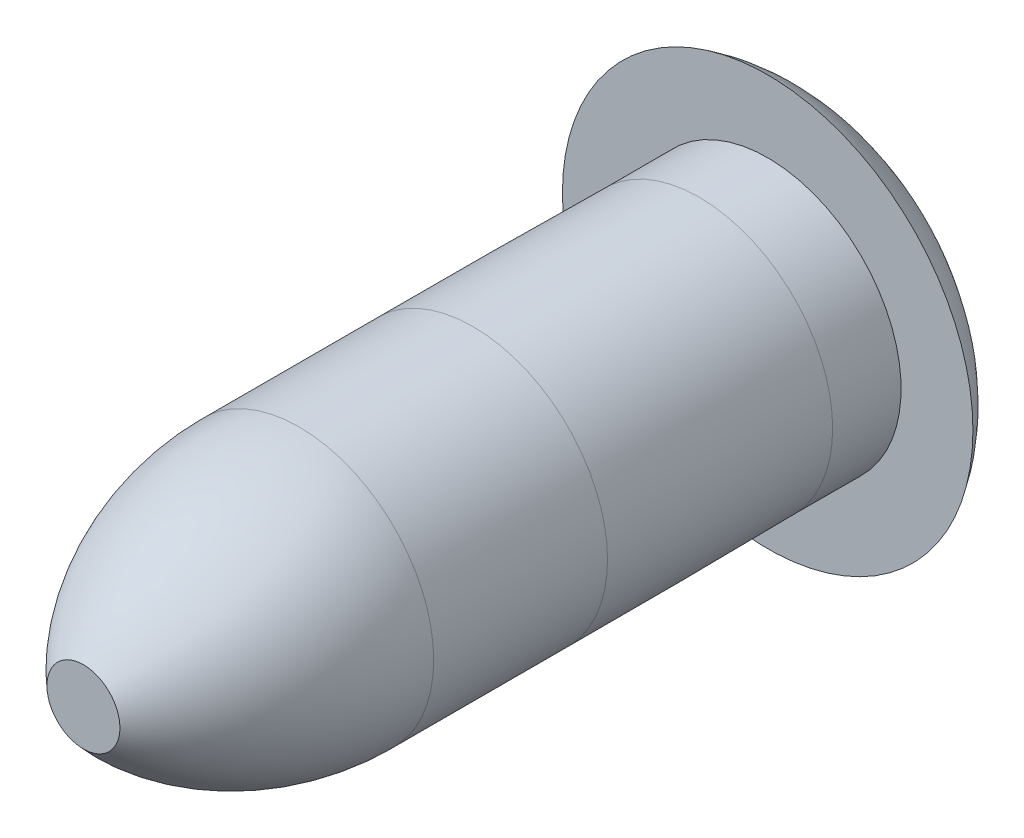
from build123d import *

# Parameters (mm, degrees)
SKETCH1_R           = 2.925
BOSS_EXTRUDE1_DEPTH = 1.5


with BuildPart() as part:
    # Sketch1 → Boss-Extrude1 (new body)
    with BuildSketch(Plane.XY):
        Circle(SKETCH1_R)
    extrude(amount=BOSS_EXTRUDE1_DEPTH)

    # Sketch2 → Revolve1 (revolve)
    with BuildSketch(Plane(origin=(0, 0, 0), x_dir=(1, 0, 0), z_dir=(0, 1, 0))):
        with BuildLine():
            Line((0, 1.4), (2, 1.4))
            ThreePointArc((2, 1.4), (3.432654878, 1.026169425), (4.5, 0))
            Line((4.5, 0), (0, 0))
            Line((0, 0), (0, 1.4))
        make_face()
    revolve(axis=Axis((0, 0, -1.4), (0, 0, 1)))

    # Sketch3 → Revolve3 (revolve)
    with BuildSketch(Plane(origin=(0, 0, 0), x_dir=(1, 0, 0), z_dir=(0, 1, 0))):
        with BuildLine():
            Line((0, 0), (0, -15))
            Line((0, -15), (0.8, -15))
            ThreePointArc((0.8, -15), (2.387266328, -12.868663731), (2.95, -10.271484588))
            Line((2.95, -10.271484588), (2.95, -6.460621543))
            ThreePointArc((2.95, -6.460621543), (2.94374996, -3.980279274), (2.925, -1.5))
            Line((2.925, -1.5), (2.925, 0))
            Line((2.925, 0), (0, 0))
        make_face()
        with BuildLine():
            Line((0.8, -14.6), (0.8, -1.5))
            ThreePointArc((0.8, -1.5), (2.100872626, -3.969683295), (2.55, -6.724658752))
            Line((2.55, -6.724658752), (2.55, -10.675570471))
            ThreePointArc((2.55, -10.675570471), (2.092677137, -12.824037781), (0.8, -14.6))
        make_face(mode=Mode.SUBTRACT)
    revolve(axis=Axis((0, 0, 0), (0, 0, 1)))


solid = part.part
